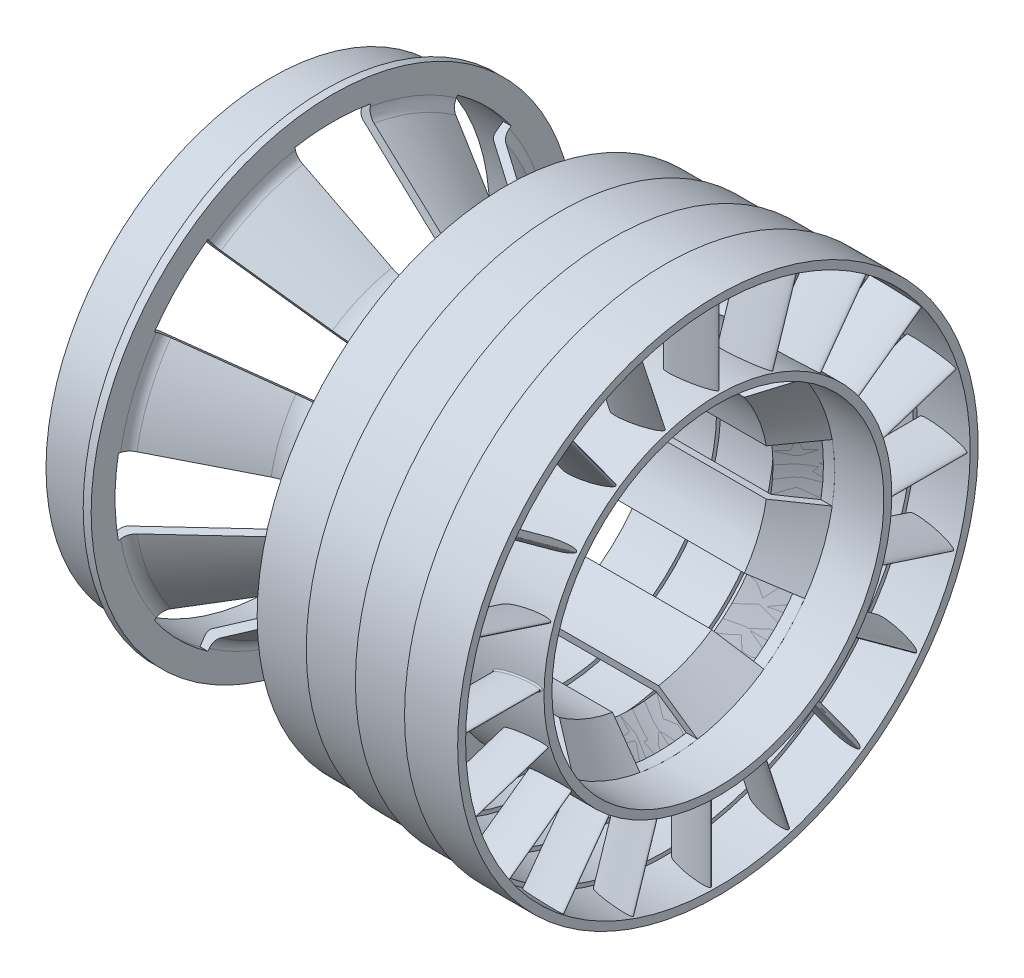
from build123d import *

# Parameters (mm, degrees)
FILLET1_R                = 5
FILLET2_R                = 3
CUT_REVOLVE2_ANGLE       = 20
CIRPATTERN1_COUNT        = 8
SKETCH8_R                = 6.5
SKETCH8_R_2              = 5
BOSS_EXTRUDE2_DEPTH      = 5
SKETCH7_R                = 5
CUT_EXTRUDE6_DEPTH       = 169.821618488
CIRPATTERN6_COUNT        = 10
BOSS_EXTRUDE3_REACH      = 259.471
BOSS_EXTRUDE3_END_RADIUS = 95
BOSS_EXTRUDE3_START      = 65
SKETCH9_RX               = 9
SKETCH9_RY               = 1.5
FILLET4_R                = 0.5
CIRPATTERN7_COUNT        = 20


with BuildPart() as part:
    # Sketch1 → Revolve1 (revolve)
    with BuildSketch(Plane.XY):
        with BuildLine():
            Line((-37.15692439, 90.5), (-45.555777439, 90.5))
            Line((-45.555777439, 90.5), (-45.555777439, 93.5))
            Line((-45.555777439, 93.5), (-25.555777439, 93.5))
            Line((-25.555777439, 93.5), (-25.555777439, 95))
            Line((-25.555777439, 95), (-5.555777439, 95))
            Line((-5.555777439, 95), (-5.555777439, 96.5))
            Line((-5.555777439, 96.5), (14.444222561, 96.5))
            Line((14.444222561, 96.5), (14.444222561, 98))
            Line((14.444222561, 98), (34.444222561, 98))
            Line((34.444222561, 98), (34.444222561, 95))
            Line((34.444222561, 95), (14.444222561, 95))
            Line((14.444222561, 95), (14.444222561, 93.5))
            Line((14.444222561, 93.5), (-5.555777439, 93.5))
            Line((-5.555777439, 93.5), (-5.555777439, 92))
            Line((-5.555777439, 92), (-25.555777439, 92))
            Line((-25.555777439, 92), (-25.555777439, 90.5))
            Line((-25.555777439, 90.5), (-34.15692439, 90.5))
            Line((-34.15692439, 90.5), (-34.15692439, 62.5))
            Line((-34.15692439, 62.5), (-25.555777439, 62.5))
            Line((-25.555777439, 62.5), (-25.555777439, 64))
            Line((-25.555777439, 64), (-5.555777439, 64))
            Line((-5.555777439, 64), (-5.555777439, 65.5))
            Line((-5.555777439, 65.5), (34.444222561, 65.5))
            Line((34.444222561, 65.5), (34.444222561, 62.5))
            Line((34.444222561, 62.5), (15.944222561, 62.5))
            Line((15.944222561, 62.5), (3.444222561, 50))
            Line((3.444222561, 50), (-69.734216876, 50))
            ThreePointArc((-69.734216876, 50), (-74.857220101, 50.790285692), (-79.503913191, 53.087666123))
            Line((-79.503913191, 53.087666123), (-113.555777439, 77))
            Line((-113.555777439, 77), (-113.555777439, 82))
            Line((-113.555777439, 82), (-133.555777439, 82))
            Line((-133.555777439, 82), (-133.555777439, 85))
            Line((-133.555777439, 85), (-113.555777439, 85))
            Line((-113.555777439, 85), (-113.555777439, 91))
            Line((-113.555777439, 91), (-110.555777439, 91))
            Line((-110.555777439, 91), (-110.555777439, 78.559113751))
            Line((-110.555777439, 78.559113751), (-78.555777439, 56.087666123))
            ThreePointArc((-78.555777439, 56.087666123), (-73.909084348, 53.790285692), (-68.786081123, 53))
            Line((-68.786081123, 53), (2.201581874, 53))
            Line((2.201581874, 53), (11.701581874, 62.5))
            Line((11.701581874, 62.5), (-5.555777439, 62.5))
            Line((-5.555777439, 62.5), (-5.555777439, 61))
            Line((-5.555777439, 61), (-25.555777439, 61))
            Line((-25.555777439, 61), (-25.555777439, 59.5))
            Line((-25.555777439, 59.5), (-45.555777439, 59.5))
            Line((-45.555777439, 59.5), (-45.555777439, 62.5))
            Line((-45.555777439, 62.5), (-37.15692439, 62.5))
            Line((-37.15692439, 62.5), (-37.15692439, 90.5))
        make_face()
    revolve(axis=Axis((-65, 0, 0), (1, 0, 0)))

    # Fillet1
    fillet1_edges = [part.edges().sort_by_distance(p)[0] for p in [
        (-110.555777439, -78.559113751, 0),
    ]]
    fillet(fillet1_edges, radius=FILLET1_R)

    # Fillet2
    fillet2_edges = [part.edges().sort_by_distance(p)[0] for p in [
        (-113.555777439, -77, 0),
    ]]
    fillet(fillet2_edges, radius=FILLET2_R)

    # Sketch2 → Cut-Revolve2 (revolve, symmetric, cut)
    with BuildSketch(Plane.XY) as cut_revolve2_sk:
        Polygon((-139.781739759, 0), (-139.781739759, 81.995581974), (-45.555777439, 81.995581974), (-45.555777439, 53), (2.201581874, 53), (11.701581874, 62.490157483), (54.354112995, 62.490157483), (54.354112995, 0), align=None)
    cut_revolve2 = revolve(axis=Axis((-183.293464212, 0, 0), (1, 0, 0)), revolution_arc=CUT_REVOLVE2_ANGLE / 2, mode=Mode.SUBTRACT)
    cut_revolve2 = cut_revolve2 + revolve(cut_revolve2_sk.sketch, axis=Axis((-183.293464212, 0, 0), (-1, 0, 0)), revolution_arc=CUT_REVOLVE2_ANGLE / 2, mode=Mode.SUBTRACT)

    # CirPattern1: Cut-Revolve2 ×8 about axis
    cirpattern1_axis = Axis((-112.279841494, 0, 0), (-1, 0, 0))
    for i in range(1, CIRPATTERN1_COUNT):
        add(cut_revolve2.rotate(cirpattern1_axis, i * 360 / CIRPATTERN1_COUNT), mode=Mode.SUBTRACT)

    # Sketch8 → Boss-Extrude2 (add)
    with BuildSketch(Plane.ZY.offset(37.15692439)):
        with Locations((0, 75)):
            Circle(SKETCH8_R)
        with Locations((0, 75)):
            Circle(SKETCH8_R_2, mode=Mode.SUBTRACT)
    boss_extrude2 = extrude(amount=BOSS_EXTRUDE2_DEPTH)

    # Sketch7 → Cut-Extrude6 (cut, through all)
    with BuildSketch(Plane.ZY.offset(37.15692439)):
        with Locations((0, 75)):
            Circle(SKETCH7_R)
    cut_extrude6 = extrude(amount=-CUT_EXTRUDE6_DEPTH, mode=Mode.SUBTRACT)

    # CirPattern6: Boss-Extrude2, Cut-Extrude6 ×10 about axis
    cirpattern6_axis = Axis((-45.555777439, 0, 0), (-1, 0, 0))
    add([boss_extrude2.rotate(cirpattern6_axis, i * 360 / CIRPATTERN6_COUNT) for i in range(1, CIRPATTERN6_COUNT)])
    add([cut_extrude6.rotate(cirpattern6_axis, i * 360 / CIRPATTERN6_COUNT) for i in range(1, CIRPATTERN6_COUNT)], mode=Mode.SUBTRACT)

    # Boss-Extrude3: up to this cylinder (the profile starts inside it)
    boss_extrude3_end = Plane(origin=(24.444223, 0, 0), z_dir=(-1, 0, 0)) * Cylinder(BOSS_EXTRUDE3_END_RADIUS, 709.942, mode=Mode.PRIVATE)
    # Sketch9 → Boss-Extrude3 (add, up to the surface)
    with BuildSketch(Plane.XY.offset(BOSS_EXTRUDE3_START), mode=Mode.PRIVATE) as boss_extrude3_sk1:
        with Locations(Location((24.444222561, 0), (0, 0, -170))):
            Ellipse(SKETCH9_RX, SKETCH9_RY)
    boss_extrude3_tool1 = extrude(boss_extrude3_sk1.sketch, amount=BOSS_EXTRUDE3_REACH, mode=Mode.PRIVATE) & boss_extrude3_end
    boss_extrude3 = boss_extrude3_tool1.solids().sort_by_distance((24.444223, 0, 65))[0]
    add(boss_extrude3)

    # Fillet4
    fillet4_edges = [part.edges().sort_by_distance(p)[0] for p in [
        (33.307492359, 1.562833607, 94.987144136),
        (33.307492361, 1.562833607, 65.481352698),
    ]]
    fillet(fillet4_edges, radius=FILLET4_R)

    # CirPattern7: Boss-Extrude3 ×20 about axis
    cirpattern7_axis = Axis((-65, 0, 0), (-1, 0, 0))
    for i in range(1, CIRPATTERN7_COUNT):
        add(boss_extrude3.rotate(cirpattern7_axis, i * 360 / CIRPATTERN7_COUNT))


solid = part.part
